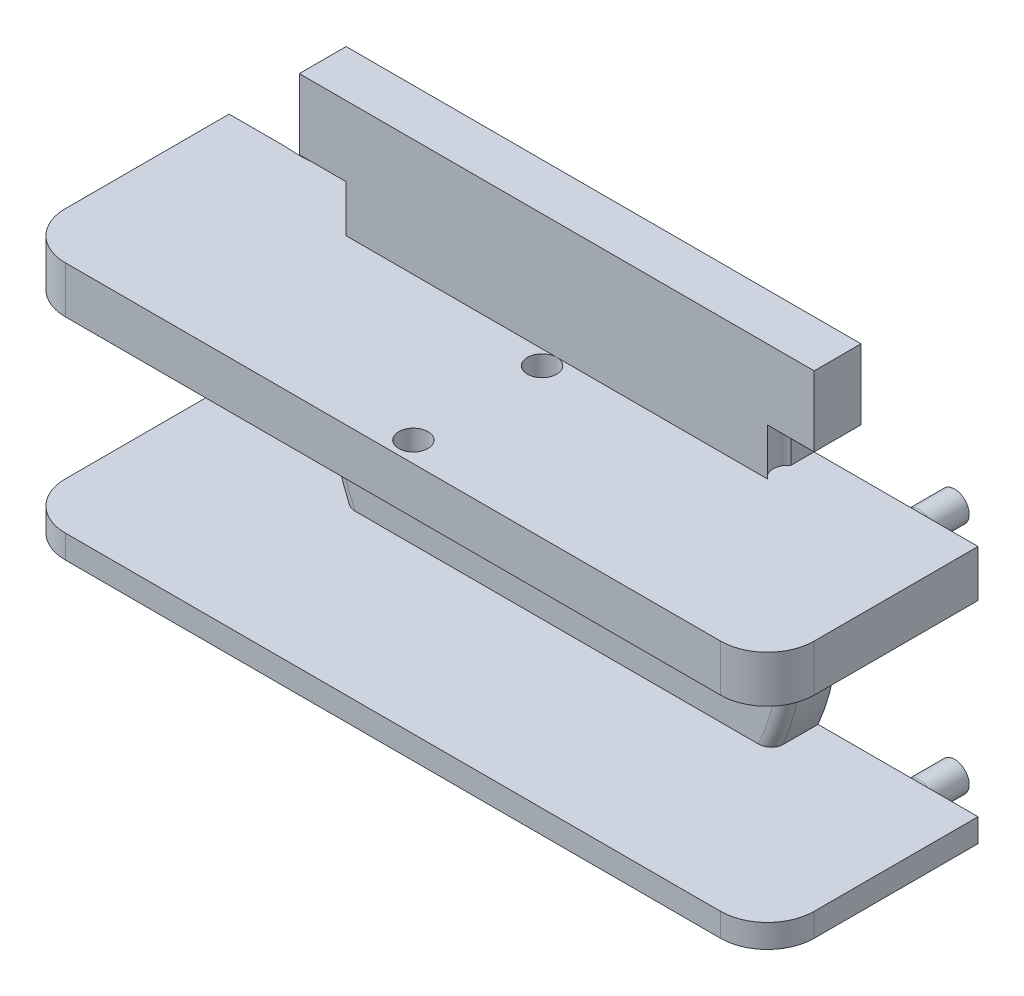
from build123d import *

# Parameters (mm, degrees)
BOSS_EXTRUDE1_DEPTH     = 2
SKETCH2_R               = 1.575
BOSS_EXTRUDE2_DEPTH     = 4
SKETCH3_R               = 1.8
BOSS_EXTRUDE3_DEPTH     = 0.4
SKETCH4_W               = 2
SKETCH4_H               = 17
BOSS_EXTRUDE4_DEPTH     = 0.001
SKETCH5_W               = 18
SKETCH5_H               = 2
BOSS_EXTRUDE5_DEPTH     = 0.001
SKETCH6_W               = 2.001
SKETCH6_H               = 2
BOSS_EXTRUDE6_DEPTH     = 5
BOSS_EXTRUDE7_DEPTH     = 0.001
CUT_EXTRUDE1_DEPTH      = 20.519323784
SKETCH9_W               = 2.937742252
SKETCH9_H               = 8
CUT_EXTRUDE2_DEPTH      = 0.001
CUT_EXTRUDE11_START     = -0.001
SKETCH21_R              = 9.75
SKETCH21_R_2            = 1.8
CUT_EXTRUDE11_DEPTH     = 0.001
SKETCH10_W              = 32
SKETCH10_H              = 2
BOSS_EXTRUDE8_DEPTH     = 7
FILLET1_R               = 0.5
SKETCH11_R              = 0.625
BOSS_EXTRUDE9_DEPTH     = 2
SKETCH14_W              = 2
SKETCH14_H              = 2
CUT_EXTRUDE5_DEPTH      = 22.401355237
SKETCH12_R              = 0.675
CUT_EXTRUDE3_DEPTH      = 2.5
CUT_EXTRUDE6_DEPTH      = 2
FILLET2_R               = 0.5
FILLET3_R               = 0.5
FILLET4_R               = 2
CUT_EXTRUDE7_DEPTH      = 26.019992106
CUT_EXTRUDE7_DEPTH_BACK = 1
SKETCH19_R              = 0.625
CUT_EXTRUDE9_DEPTH      = 2


with BuildPart() as part:
    # Sketch1 → Boss-Extrude1 (new body)
    with BuildSketch(Plane.XY):
        Polygon((-11, 6), (-11, 11), (11, 11), (11, 6), (11, -6), (-11, -6), align=None)
    extrude(amount=BOSS_EXTRUDE1_DEPTH)

    # Sketch3 → Boss-Extrude3 (add)
    with BuildSketch(Plane(origin=(0, 0, 0), x_dir=(-1, 0, 0), z_dir=(0, 0, -1))):
        with Locations(Location((0, 0, 0), (0, 0, 180))):
            Circle(SKETCH3_R)
    extrude(amount=BOSS_EXTRUDE3_DEPTH)

    # Sketch4 → Boss-Extrude4 (add)
    with BuildSketch(Plane(origin=(0, 0, 0), x_dir=(-1, 0, 0), z_dir=(0, 0, -1))):
        with Locations((10, 2.5)):
            Rectangle(SKETCH4_W, SKETCH4_H)
        with Locations((-10, 2.5)):
            Rectangle(SKETCH4_W, SKETCH4_H)
    extrude(amount=BOSS_EXTRUDE4_DEPTH)

    # Sketch5 → Boss-Extrude5 (add)
    with BuildSketch(Plane(origin=(0, 0, 0), x_dir=(-1, 0, 0), z_dir=(0, 0, -1))):
        with Locations((0, 10)):
            Rectangle(SKETCH5_W, SKETCH5_H)
    extrude(amount=BOSS_EXTRUDE5_DEPTH)

    # Sketch6 → Boss-Extrude6 (add)
    with BuildSketch(Plane(origin=(11, 0, 0), x_dir=(0, 0, -1), z_dir=(1, 0, 0))):
        with Locations((-0.9995, -5)):
            Rectangle(SKETCH6_W, SKETCH6_H)
        with Locations((-0.9995, 5)):
            Rectangle(SKETCH6_W, SKETCH6_H)
    boss_extrude6 = extrude(amount=BOSS_EXTRUDE6_DEPTH)

    # Mirror1: Boss-Extrude6 across plane
    add(boss_extrude6.mirror(Plane(origin=(0, 0, 0), x_dir=(0, 0, 1), z_dir=(1, 0, 0))))

    # Sketch7 → Boss-Extrude7 (add)
    with BuildSketch(Plane(origin=(0, 0, -0.001), x_dir=(-1, 0, 0), z_dir=(0, 0, -1))):
        with BuildLine():
            ThreePointArc((-6.708203932, -6), (-8.407551231, -3.211398808), (-9, 0))
            Line((-9, 0), (-9, -6))
            Line((-9, -6), (-6.708203932, -6))
        make_face()
        with BuildLine():
            Line((-9, 9), (-9, 0))
            ThreePointArc((-9, 0), (-6.363961031, 6.363961031), (0, 9))
            Line((0, 9), (-9, 9))
        make_face()
    boss_extrude7 = extrude(amount=-BOSS_EXTRUDE7_DEPTH)

    # Sketch8 → Cut-Extrude1 (cut, through all)
    with BuildSketch(Plane(origin=(0, 0, -0.001), x_dir=(-1, 0, 0), z_dir=(0, 0, -1))):
        with BuildLine():
            Line((-11, 4), (-9.16515139, 4))
            ThreePointArc((-9.16515139, 4), (-10, 0), (-9.16515139, -4))
            Line((-9.16515139, -4), (-11, -4))
            Line((-11, -4), (-11, 4))
        make_face()
    cut_extrude1 = extrude(amount=-CUT_EXTRUDE1_DEPTH, mode=Mode.SUBTRACT)

    # Sketch9 → Cut-Extrude2 (cut)
    with BuildSketch(Plane(origin=(0, 0, -0.001), x_dir=(-1, 0, 0), z_dir=(0, 0, -1))):
        with Locations((-9.531128874, 0)):
            Rectangle(SKETCH9_W, SKETCH9_H)
    cut_extrude2 = extrude(amount=-CUT_EXTRUDE2_DEPTH, mode=Mode.SUBTRACT)

    # Mirror2: Boss-Extrude7, Cut-Extrude1, Cut-Extrude2 across plane
    add(boss_extrude7.mirror(Plane(origin=(0, 0, 0), x_dir=(0, 0, 1), z_dir=(1, 0, 0))))
    add(cut_extrude1.mirror(Plane(origin=(0, 0, 0), x_dir=(0, 0, 1), z_dir=(1, 0, 0))), mode=Mode.SUBTRACT)
    add(cut_extrude2.mirror(Plane(origin=(0, 0, 0), x_dir=(0, 0, 1), z_dir=(1, 0, 0))), mode=Mode.SUBTRACT)

    # Sketch21 → Cut-Extrude11 (cut)
    with BuildSketch(Plane(origin=(0, 0, -0.001), x_dir=(-1, 0, 0), z_dir=(0, 0, -1)).offset(CUT_EXTRUDE11_START)):
        Circle(SKETCH21_R)
        with Locations(Location((0, 0, 0), (0, 0, 180))):
            Circle(SKETCH21_R_2, mode=Mode.SUBTRACT)
    extrude(amount=CUT_EXTRUDE11_DEPTH, mode=Mode.SUBTRACT)

    # Sketch10 → Boss-Extrude8 (add)
    with BuildSketch(Plane.XY.offset(2)):
        with Locations((0, -5)):
            Rectangle(SKETCH10_W, SKETCH10_H)
        with Locations((0, 5)):
            Rectangle(SKETCH10_W, SKETCH10_H)
    extrude(amount=BOSS_EXTRUDE8_DEPTH)

    # Fillet1
    fillet1_edges = [part.edges().sort_by_distance(p)[0] for p in [
        (10, 0, 2),
        (-10, 0, 2),
    ]]
    fillet(fillet1_edges, radius=FILLET1_R)

    # Sketch11 → Boss-Extrude9 (add)
    with BuildSketch(Plane(origin=(0, 0, -0.001), x_dir=(-1, 0, 0), z_dir=(0, 0, -1))):
        with Locations(Location((-13, -5, 0), (0, 0, 180))):
            Circle(SKETCH11_R)
    boss_extrude9 = extrude(amount=BOSS_EXTRUDE9_DEPTH)

    # Sketch14 → Cut-Extrude5 (cut, through all)
    with BuildSketch(Plane(origin=(0, 0, -0.001), x_dir=(-1, 0, 0), z_dir=(0, 0, -1))):
        with Locations((10, 7)):
            Rectangle(SKETCH14_W, SKETCH14_H)
        with Locations((-10, 7)):
            Rectangle(SKETCH14_W, SKETCH14_H)
    extrude(amount=-CUT_EXTRUDE5_DEPTH, mode=Mode.SUBTRACT)

    # Sketch12 → Cut-Extrude3 (cut)
    with BuildSketch(Plane(origin=(0, 0, -0.001), x_dir=(-1, 0, 0), z_dir=(0, 0, -1))):
        with Locations((13, -5)):
            Circle(SKETCH12_R)
    cut_extrude3 = extrude(amount=-CUT_EXTRUDE3_DEPTH, mode=Mode.SUBTRACT)

    # Sketch16 → Cut-Extrude6 (cut)
    with BuildSketch(Plane(origin=(0, 6, 0), x_dir=(1, 0, 0), z_dir=(0, 1, 0))):
        with BuildLine():
            Line((-9, -1), (-9, -2))
            ThreePointArc((-9, -2), (-8.75, -1.5), (-9, -1))
        make_face()
    cut_extrude6 = extrude(amount=CUT_EXTRUDE6_DEPTH, mode=Mode.SUBTRACT)

    # Mirror3: Boss-Extrude9, Cut-Extrude3 across plane
    add(boss_extrude9.mirror(Plane.ZX))
    add(cut_extrude3.mirror(Plane.ZX), mode=Mode.SUBTRACT)

    # Mirror4: Cut-Extrude6 across plane
    add(cut_extrude6.mirror(Plane(origin=(0, 0, 0), x_dir=(0, 0, 1), z_dir=(1, 0, 0))), mode=Mode.SUBTRACT)

    # Fillet2
    fillet2_edges = [part.edges().sort_by_distance(p)[0] for p in [
        (12.375, -5, -0.001),
        (12.375, 5, -0.001),
    ]]
    fillet(fillet2_edges, radius=FILLET2_R)

    # Fillet3
    # the kernel refuses this fillet: 0.5 mm, written as the material it takes off along each edge
    with BuildSketch(Plane(origin=(-13, -5, -0.001), x_dir=(-1, 0, 0), z_dir=(0, -1, 0))) as fillet3_piece_1:
        with BuildLine():
            CenterArc((0.675 + FILLET3_R, -FILLET3_R), FILLET3_R, 90, 90)
            Line((0.675, -FILLET3_R), (0.675, 0))
            Line((0.675, 0), (0.675 + FILLET3_R, 0))
        make_face()
    revolve(axis=Axis((-13, -5, -0.001), (0, 0, -1)), mode=Mode.SUBTRACT)
    with BuildSketch(Plane(origin=(-13, 5, -0.001), x_dir=(-1, 0, 0), z_dir=(0, 1, 0))) as fillet3_piece_2:
        with BuildLine():
            CenterArc((0.675 + FILLET3_R, FILLET3_R), FILLET3_R, 180, 90)
            Line((0.675, FILLET3_R), (0.675, 0))
            Line((0.675, 0), (0.675 + FILLET3_R, 0))
        make_face()
    revolve(axis=Axis((-13, 5, -0.001), (0, 0, 1)), mode=Mode.SUBTRACT)

    # Fillet4
    fillet4_edges = [part.edges().sort_by_distance(p)[0] for p in [
        (16, -5, 9),
        (-16, -5, 9),
        (-16, 5, 9),
        (16, 5, 9),
    ]]
    fillet(fillet4_edges, radius=FILLET4_R)

    # Sketch17 → Cut-Extrude7 (cut, two sides: drawn at the far end of the back side and taken through both)
    with BuildSketch(Plane.XZ.offset(6).offset(-CUT_EXTRUDE7_DEPTH_BACK)):
        with BuildLine():
            Line((-16, 7), (-16, -0.001))
            Line((-16, -0.001), (-14.5, -0.001))
            Line((-14.5, -0.001), (-14.5, 7))
            ThreePointArc((-14.5, 7), (-14.353553391, 7.353553391), (-14, 7.5))
            Line((-14, 7.5), (14, 7.5))
            ThreePointArc((14, 7.5), (14.353553391, 7.353553391), (14.5, 7))
            Line((14.5, 7), (14.5, -0.001))
            Line((14.5, -0.001), (16, -0.001))
            Line((16, -0.001), (16, 7))
            ThreePointArc((16, 7), (15.414213562, 8.414213562), (14, 9))
            Line((14, 9), (-14, 9))
            ThreePointArc((-14, 9), (-15.414213562, 8.414213562), (-16, 7))
        make_face()
    extrude(amount=CUT_EXTRUDE7_DEPTH + CUT_EXTRUDE7_DEPTH_BACK, mode=Mode.SUBTRACT)

    # Sketch19 → Cut-Extrude9 (cut)
    with BuildSketch(Plane(origin=(0, 6, 0), x_dir=(1, 0, 0), z_dir=(0, 1, 0))):
        with Locations(Location((0, -2.625, 0), (0, 0, 90))):
            Circle(SKETCH19_R)
        with Locations(Location((0, -8.125, 0), (0, 0, 270))):
            Circle(SKETCH19_R)
    extrude(amount=-CUT_EXTRUDE9_DEPTH, mode=Mode.SUBTRACT)


with BuildPart() as body_2:
    # Sketch2 → Boss-Extrude2 (new body)
    with BuildSketch(Plane(origin=(0, 0, 2), x_dir=(-1, 0, 0), z_dir=(0, 0, -1))):
        Circle(SKETCH2_R)
    extrude(amount=BOSS_EXTRUDE2_DEPTH)


with BuildPart() as part_1:
    add(part.part)

    # Combine2: cut body 2
    add(body_2.part, mode=Mode.SUBTRACT)


solid = part_1.part
